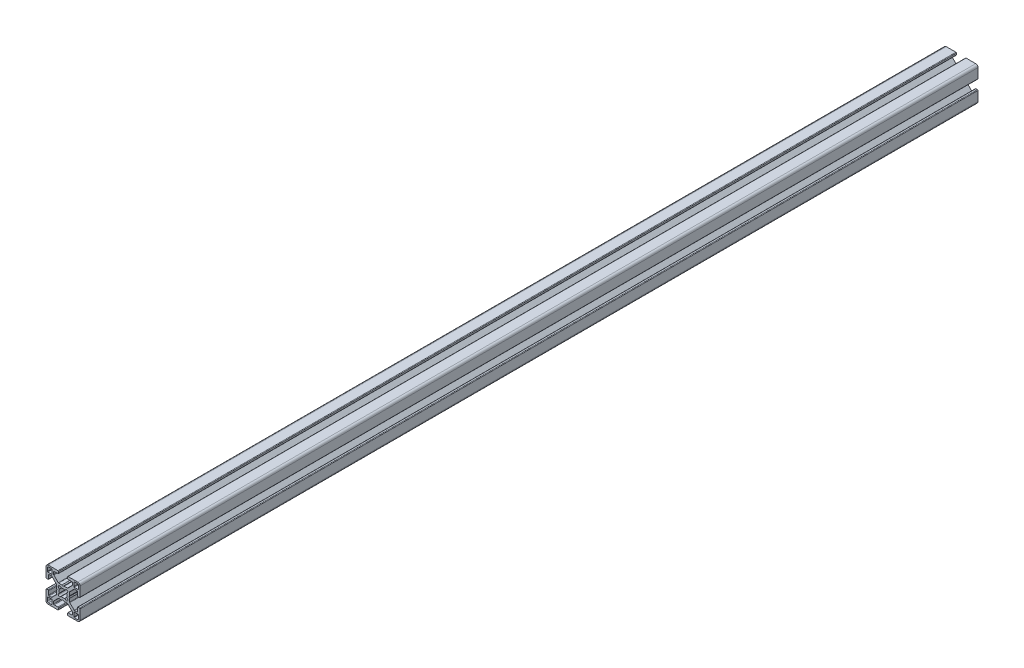
from build123d import *

# Parameters (mm, degrees)
EXTRUSION1_DEPTH = 792


with BuildPart() as part:
    # Esboço1 → Extrusion1 (new body)
    with BuildSketch(Plane.XY):
        with BuildLine():
            ThreePointArc((-15, -13), (-14.414213562, -14.414213562), (-13, -15))
            Line((-13, -15), (-4.508, -15))
            ThreePointArc((-4.508, -15), (-4.148789755, -14.851210245), (-4, -14.492))
            Line((-4, -14.492), (-4, -13.251))
            ThreePointArc((-4, -13.251), (-4.148789755, -12.891789755), (-4.508, -12.743))
            Line((-4.508, -12.743), (-7.742, -12.743))
            ThreePointArc((-7.742, -12.743), (-8.101210245, -12.594210245), (-8.25, -12.235))
            Line((-8.25, -12.235), (-8.25, -10.264165074))
            ThreePointArc((-8.25, -10.264165074), (-8.211330803, -10.06976189), (-8.101210245, -9.904954829))
            Line((-8.101210245, -9.904954829), (-4.179545171, -5.983289755))
            ThreePointArc((-4.179545171, -5.983289755), (-4.01473811, -5.873169197), (-3.820334926, -5.8345))
            Line((-3.820334926, -5.8345), (-0.949019985, -5.8345))
            Line((-0.949019985, -5.8345), (0, -5.325))
            Line((0, -5.325), (0.949019985, -5.8345))
            Line((0.949019985, -5.8345), (3.82157951, -5.8345))
            ThreePointArc((3.82157951, -5.8345), (4.015982694, -5.873169197), (4.180789755, -5.983289755))
            Line((4.180789755, -5.983289755), (8.101210245, -9.903710245))
            ThreePointArc((8.101210245, -9.903710245), (8.211330803, -10.068517306), (8.25, -10.26292049))
            Line((8.25, -10.26292049), (8.25, -12.235))
            ThreePointArc((8.25, -12.235), (8.101210245, -12.594210245), (7.742, -12.743))
            Line((7.742, -12.743), (4.508, -12.743))
            ThreePointArc((4.508, -12.743), (4.148789755, -12.891789755), (4, -13.251))
            Line((4, -13.251), (4, -14.492))
            ThreePointArc((4, -14.492), (4.148789755, -14.851210245), (4.508, -15))
            Line((4.508, -15), (13, -15))
            ThreePointArc((13, -15), (14.414213562, -14.414213562), (15, -13))
            Line((15, -13), (15, -4.508))
            ThreePointArc((15, -4.508), (14.851210245, -4.148789755), (14.492, -4))
            Line((14.492, -4), (13.251, -4))
            ThreePointArc((13.251, -4), (12.891789755, -4.148789755), (12.743, -4.508))
            Line((12.743, -4.508), (12.743, -7.742))
            ThreePointArc((12.743, -7.742), (12.594210245, -8.101210245), (12.235, -8.25))
            Line((12.235, -8.25), (10.264165074, -8.25))
            ThreePointArc((10.264165074, -8.25), (10.06976189, -8.211330803), (9.904954829, -8.101210245))
            Line((9.904954829, -8.101210245), (5.983289755, -4.179545171))
            ThreePointArc((5.983289755, -4.179545171), (5.873169197, -4.01473811), (5.8345, -3.820334926))
            Line((5.8345, -3.820334926), (5.8345, -0.949019985))
            Line((5.8345, -0.949019985), (5.325, 0))
            Line((5.325, 0), (5.8345, 0.949019985))
            Line((5.8345, 0.949019985), (5.8345, 3.82157951))
            ThreePointArc((5.8345, 3.82157951), (5.873169197, 4.015982694), (5.983289755, 4.180789755))
            Line((5.983289755, 4.180789755), (9.903710245, 8.101210245))
            ThreePointArc((9.903710245, 8.101210245), (10.068517306, 8.211330803), (10.26292049, 8.25))
            Line((10.26292049, 8.25), (12.235, 8.25))
            ThreePointArc((12.235, 8.25), (12.594210245, 8.101210245), (12.743, 7.742))
            Line((12.743, 7.742), (12.743, 4.508))
            ThreePointArc((12.743, 4.508), (12.891789755, 4.148789755), (13.251, 4))
            Line((13.251, 4), (14.492, 4))
            ThreePointArc((14.492, 4), (14.851210245, 4.148789755), (15, 4.508))
            Line((15, 4.508), (15, 13))
            ThreePointArc((15, 13), (14.414213562, 14.414213562), (13, 15))
            Line((13, 15), (4.508, 15))
            ThreePointArc((4.508, 15), (4.148789755, 14.851210245), (4, 14.492))
            Line((4, 14.492), (4, 13.251))
            ThreePointArc((4, 13.251), (4.148789755, 12.891789755), (4.508, 12.743))
            Line((4.508, 12.743), (7.742, 12.743))
            ThreePointArc((7.742, 12.743), (8.101210245, 12.594210245), (8.25, 12.235))
            Line((8.25, 12.235), (8.25, 10.264165074))
            ThreePointArc((8.25, 10.264165074), (8.211330803, 10.06976189), (8.101210245, 9.904954829))
            Line((8.101210245, 9.904954829), (4.179545171, 5.983289755))
            ThreePointArc((4.179545171, 5.983289755), (4.01473811, 5.873169197), (3.820334926, 5.8345))
            Line((3.820334926, 5.8345), (0.949019985, 5.8345))
            Line((0.949019985, 5.8345), (0, 5.325))
            Line((0, 5.325), (-0.949019985, 5.8345))
            Line((-0.949019985, 5.8345), (-3.82157951, 5.8345))
            ThreePointArc((-3.82157951, 5.8345), (-4.015982694, 5.873169197), (-4.180789755, 5.983289755))
            Line((-4.180789755, 5.983289755), (-8.101210245, 9.903710245))
            ThreePointArc((-8.101210245, 9.903710245), (-8.211330803, 10.068517306), (-8.25, 10.26292049))
            Line((-8.25, 10.26292049), (-8.25, 12.235))
            ThreePointArc((-8.25, 12.235), (-8.101210245, 12.594210245), (-7.742, 12.743))
            Line((-7.742, 12.743), (-4.508, 12.743))
            ThreePointArc((-4.508, 12.743), (-4.148789755, 12.891789755), (-4, 13.251))
            Line((-4, 13.251), (-4, 14.492))
            ThreePointArc((-4, 14.492), (-4.148789755, 14.851210245), (-4.508, 15))
            Line((-4.508, 15), (-13, 15))
            ThreePointArc((-13, 15), (-14.414213562, 14.414213562), (-15, 13))
            Line((-15, 13), (-15, 4.508))
            ThreePointArc((-15, 4.508), (-14.851210245, 4.148789755), (-14.492, 4))
            Line((-14.492, 4), (-13.251, 4))
            ThreePointArc((-13.251, 4), (-12.891789755, 4.148789755), (-12.743, 4.508))
            Line((-12.743, 4.508), (-12.743, 7.742))
            ThreePointArc((-12.743, 7.742), (-12.594210245, 8.101210245), (-12.235, 8.25))
            Line((-12.235, 8.25), (-10.264165074, 8.25))
            ThreePointArc((-10.264165074, 8.25), (-10.06976189, 8.211330803), (-9.904954829, 8.101210245))
            Line((-9.904954829, 8.101210245), (-5.983289755, 4.179545171))
            ThreePointArc((-5.983289755, 4.179545171), (-5.873169197, 4.01473811), (-5.8345, 3.820334926))
            Line((-5.8345, 3.820334926), (-5.8345, 0.949019985))
            Line((-5.8345, 0.949019985), (-5.325, 0))
            Line((-5.325, 0), (-5.8345, -0.949019985))
            Line((-5.8345, -0.949019985), (-5.8345, -3.82157951))
            ThreePointArc((-5.8345, -3.82157951), (-5.873169197, -4.015982694), (-5.983289755, -4.180789755))
            Line((-5.983289755, -4.180789755), (-9.903710245, -8.101210245))
            ThreePointArc((-9.903710245, -8.101210245), (-10.068517306, -8.211330803), (-10.26292049, -8.25))
            Line((-10.26292049, -8.25), (-12.235, -8.25))
            ThreePointArc((-12.235, -8.25), (-12.594210245, -8.101210245), (-12.743, -7.742))
            Line((-12.743, -7.742), (-12.743, -4.508))
            ThreePointArc((-12.743, -4.508), (-12.891789755, -4.148789755), (-13.251, -4))
            Line((-13.251, -4), (-14.492, -4))
            ThreePointArc((-14.492, -4), (-14.851210245, -4.148789755), (-15, -4.508))
            Line((-15, -4.508), (-15, -13))
        make_face()
        with BuildLine():
            Line((-13.7, -12.7), (-13.7, -9.881))
            ThreePointArc((-13.7, -9.881), (-13.588407684, -9.611592316), (-13.319, -9.5))
            Line((-13.319, -9.5), (-9.881, -9.5))
            ThreePointArc((-9.881, -9.5), (-9.611592316, -9.611592316), (-9.5, -9.881))
            Line((-9.5, -9.881), (-9.5, -13.319))
            ThreePointArc((-9.5, -13.319), (-9.611592316, -13.588407684), (-9.881, -13.7))
            Line((-9.881, -13.7), (-12.7, -13.7))
            ThreePointArc((-12.7, -13.7), (-13.407106781, -13.407106781), (-13.7, -12.7))
        make_face(mode=Mode.SUBTRACT)
        with BuildLine():
            Line((9.5, -13.319), (9.5, -9.881))
            ThreePointArc((9.5, -9.881), (9.611592316, -9.611592316), (9.881, -9.5))
            Line((9.881, -9.5), (13.319, -9.5))
            ThreePointArc((13.319, -9.5), (13.588407684, -9.611592316), (13.7, -9.881))
            Line((13.7, -9.881), (13.7, -12.7))
            ThreePointArc((13.7, -12.7), (13.407106781, -13.407106781), (12.7, -13.7))
            Line((12.7, -13.7), (9.881, -13.7))
            ThreePointArc((9.881, -13.7), (9.611592316, -13.588407684), (9.5, -13.319))
        make_face(mode=Mode.SUBTRACT)
        with BuildLine():
            Line((-13.7, 9.881), (-13.7, 12.7))
            ThreePointArc((-13.7, 12.7), (-13.407106781, 13.407106781), (-12.7, 13.7))
            Line((-12.7, 13.7), (-9.881, 13.7))
            ThreePointArc((-9.881, 13.7), (-9.611592316, 13.588407684), (-9.5, 13.319))
            Line((-9.5, 13.319), (-9.5, 9.881))
            ThreePointArc((-9.5, 9.881), (-9.611592316, 9.611592316), (-9.881, 9.5))
            Line((-9.881, 9.5), (-13.319, 9.5))
            ThreePointArc((-13.319, 9.5), (-13.588407684, 9.611592316), (-13.7, 9.881))
        make_face(mode=Mode.SUBTRACT)
        with BuildLine():
            Line((-3.198163609, 1.494205317), (-4.010726841, 2.5139095))
            ThreePointArc((-4.010726841, 2.5139095), (-3.900018469, 3.900018469), (-2.5139095, 4.010726841))
            Line((-2.5139095, 4.010726841), (-1.494205317, 3.198163609))
            ThreePointArc((-1.494205317, 3.198163609), (0, 3.53), (1.494205317, 3.198163609))
            Line((1.494205317, 3.198163609), (2.5139095, 4.010726841))
            ThreePointArc((2.5139095, 4.010726841), (3.900018469, 3.900018469), (4.010726841, 2.5139095))
            Line((4.010726841, 2.5139095), (3.198163609, 1.494205317))
            ThreePointArc((3.198163609, 1.494205317), (3.53, 0), (3.198163609, -1.494205317))
            Line((3.198163609, -1.494205317), (4.010726841, -2.5139095))
            ThreePointArc((4.010726841, -2.5139095), (3.900018469, -3.900018469), (2.5139095, -4.010726841))
            Line((2.5139095, -4.010726841), (1.494205317, -3.198163609))
            ThreePointArc((1.494205317, -3.198163609), (0, -3.53), (-1.494205317, -3.198163609))
            Line((-1.494205317, -3.198163609), (-2.5139095, -4.010726841))
            ThreePointArc((-2.5139095, -4.010726841), (-3.900018469, -3.900018469), (-4.010726841, -2.5139095))
            Line((-4.010726841, -2.5139095), (-3.198163609, -1.494205317))
            ThreePointArc((-3.198163609, -1.494205317), (-3.53, 0), (-3.198163609, 1.494205317))
        make_face(mode=Mode.SUBTRACT)
        with BuildLine():
            Line((9.5, 9.881), (9.5, 13.319))
            ThreePointArc((9.5, 13.319), (9.611592316, 13.588407684), (9.881, 13.7))
            Line((9.881, 13.7), (12.7, 13.7))
            ThreePointArc((12.7, 13.7), (13.407106781, 13.407106781), (13.7, 12.7))
            Line((13.7, 12.7), (13.7, 9.881))
            ThreePointArc((13.7, 9.881), (13.588407684, 9.611592316), (13.319, 9.5))
            Line((13.319, 9.5), (9.881, 9.5))
            ThreePointArc((9.881, 9.5), (9.611592316, 9.611592316), (9.5, 9.881))
        make_face(mode=Mode.SUBTRACT)
    extrude(amount=-EXTRUSION1_DEPTH)


solid = part.part
